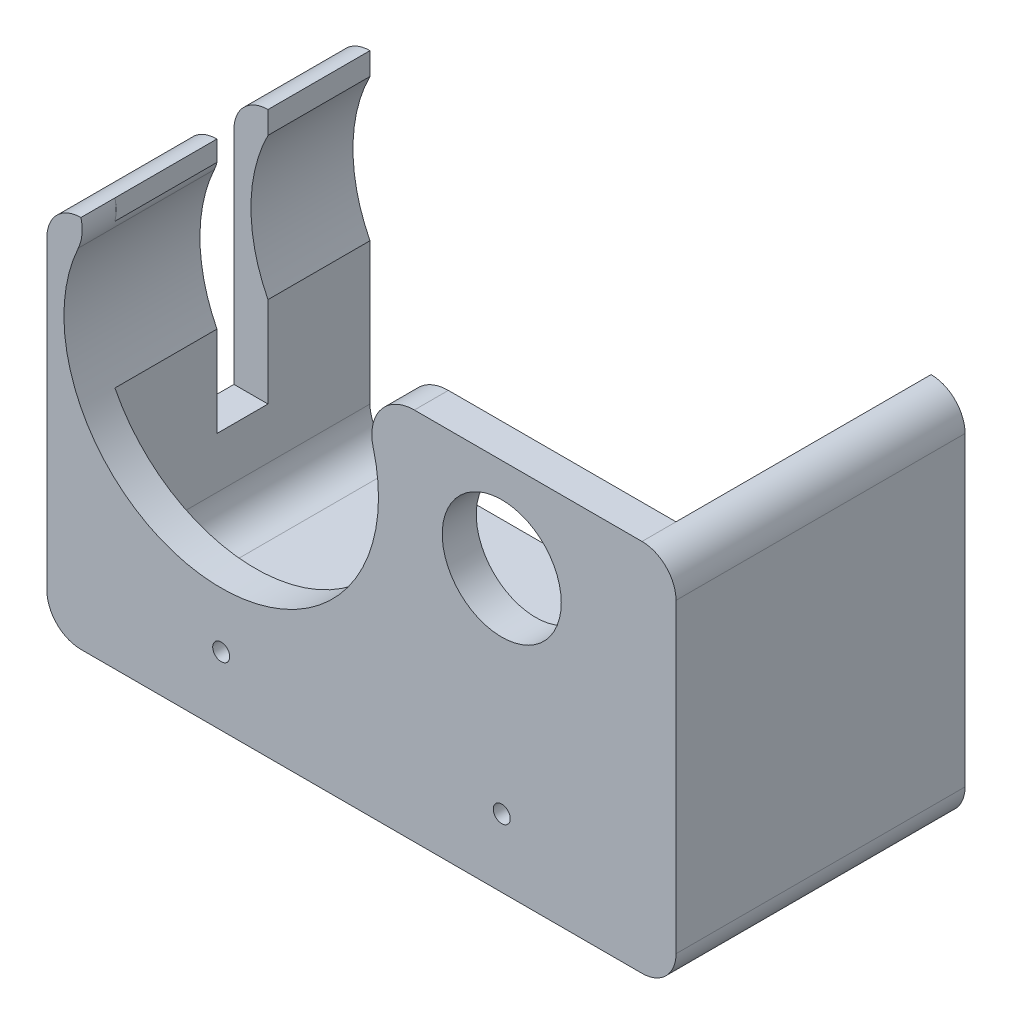
from build123d import *

# Parameters (mm, degrees)
ESQUISSE2_W             = 74
ESQUISSE2_H             = 44
BOSS_EXTRU_1_DEPTH      = 4
ESQUISSE4_R             = 7
ESQUISSE4_R_2           = 18.5
ESQUISSE4_R_3           = 1
ENL_V_MAT_EXTRU_1_DEPTH = 71.394310982
BOSS_EXTRU_2_START      = -4
BOSS_EXTRU_2_DEPTH      = 34
CONG_1_R                = 4
ESQUISSE7_W             = 6
ESQUISSE7_H             = 30
ENL_V_MAT_EXTRU_2_DEPTH = 10
CONG_2_START            = -13
CONG_2_DEPTH            = 18
ESQUISSE8_W             = 5
ESQUISSE8_H             = 10
ENL_V_MAT_EXTRU_3_DEPTH = 77.369560077


with BuildPart() as part:
    # Esquisse2 → Boss.-Extru.1 (new body)
    with BuildSketch(Plane.XY):
        with Locations((-20.726161369, 18.08801956)):
            Rectangle(ESQUISSE2_W, ESQUISSE2_H)
    extrude(amount=BOSS_EXTRU_1_DEPTH)

    # Esquisse4 → Enlèv. mat.-Extru.1 (cut, through all)
    with BuildSketch(Plane.XY.offset(4)):
        with Locations((-4.226161369, 29.08801956)):
            Circle(ESQUISSE4_R)
        with Locations((-37.226161369, 29.08801956)):
            Circle(ESQUISSE4_R_2)
        with Locations((-4.226161369, 4.08801956)):
            Circle(ESQUISSE4_R_3)
        with Locations((-37.226161369, 4.08801956)):
            Circle(ESQUISSE4_R_3)
    extrude(amount=-ENL_V_MAT_EXTRU_1_DEPTH, mode=Mode.SUBTRACT)

    # Boss.-Extru.2: read off the stored shape, not the designer's step
    # Boss.-Extru.2 outline → Boss.-Extru.2 (add)
    with BuildSketch(Plane(origin=(0, 0, 0), x_dir=(-1, 0, 0), z_dir=(0, 0, -1)).offset(BOSS_EXTRU_2_START)):
        with BuildLine():
            Line((-12.273838631, 40.08801956), (-16.273838631, 40.08801956))
            Line((-16.273838631, 40.08801956), (-16.273838631, -3.91198044))
            Line((-16.273838631, -3.91198044), (57.726161369, -3.91198044))
            Line((57.726161369, -3.91198044), (57.726161369, 40.08801956))
            Line((57.726161369, 40.08801956), (53.726161369, 40.08801956))
            Line((53.726161369, 40.08801956), (53.726161369, 37.454619825))
            ThreePointArc((53.726161369, 37.454619825), (55.726161369, 29.08801956), (53.726161369, 20.721419295))
            Line((53.726161369, 20.721419295), (53.726161369, 0.08801956))
            Line((53.726161369, 0.08801956), (-12.273838631, 0.08801956))
            Line((-12.273838631, 0.08801956), (-12.273838631, 40.08801956))
        make_face()
    extrude(amount=BOSS_EXTRU_2_DEPTH)

    # Congé1
    cong_1_edges = [part.edges().sort_by_distance(p)[0] for p in [
        (-53.726161369, 0.08801956, -15),
        (-57.726161369, 40.08801956, -15),
        (16.273838631, 40.08801956, -15),
        (16.273838631, -3.91198044, -15),
        (-57.726161369, -3.91198044, -15),
    ]]
    fillet(cong_1_edges, radius=CONG_1_R - 0.0001)  # a hair under: the kernel refuses the full size

    # Esquisse7 → Enlèv. mat.-Extru.2 (cut)
    with BuildSketch(Plane.ZY.offset(57.726161369)):
        with Locations((-15, 25.08801956)):
            Rectangle(ESQUISSE7_W, ESQUISSE7_H)
    extrude(amount=-ENL_V_MAT_EXTRU_2_DEPTH, mode=Mode.SUBTRACT)

    # Congé2: read off the stored shape, not the designer's step
    # Congé2 outline → Congé2 (cut)
    with BuildSketch(Plane.XY.offset(CONG_2_START)):
        with BuildLine():
            Line((-52.10063615, 40.08801956), (-53.726161369, 40.08801956))
            ThreePointArc((-53.726161369, 40.08801956), (-53.604311661, 38.421947689), (-54.038082686, 36.808725593))
            ThreePointArc((-54.038082686, 36.808725593), (-53.153978754, 38.498366704), (-52.10063615, 40.08801956))
        make_face()
        with BuildLine():
            ThreePointArc((-22.351686589, 40.08801956), (-20.5475812, 37.09270341), (-19.339309991, 33.811423815))
            ThreePointArc((-19.339309991, 33.811423815), (-18.466274294, 38.139004751), (-14.505025834, 40.08801956))
            Line((-14.505025834, 40.08801956), (-22.351686589, 40.08801956))
        make_face()
    extrude(amount=CONG_2_DEPTH, mode=Mode.SUBTRACT)

    # Esquisse8 → Enlèv. mat.-Extru.3 (cut, through all)
    with BuildSketch(Plane(origin=(0, 0.08801956, 0), x_dir=(1, 0, 0), z_dir=(0, 1, 0))):
        with Locations((9.773838631, 11)):
            Rectangle(ESQUISSE8_W, ESQUISSE8_H)
    extrude(amount=-ENL_V_MAT_EXTRU_3_DEPTH, mode=Mode.SUBTRACT)


solid = part.part
